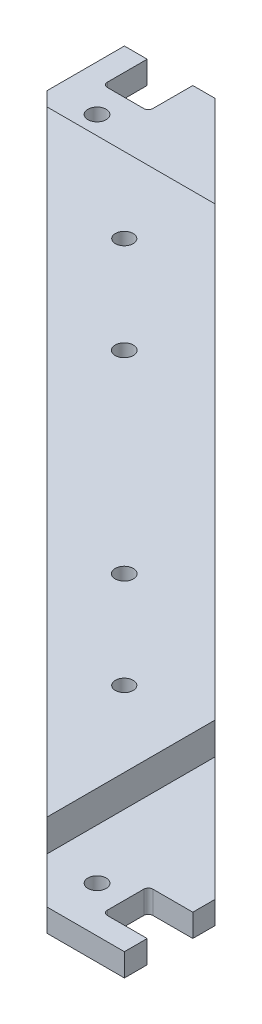
from build123d import *

# Parameters (mm, degrees)
BOSS_EXTRUDE1_DEPTH      = 12
SKETCH2_R                = 2
CUT_EXTRUDE1_DEPTH       = 244.893675605
SKETCH3_W                = 47.3
SKETCH3_H                = 27.3
SKETCH3_W_2              = 27.3
SKETCH3_H_2              = 47.3
CUT_EXTRUDE2_DEPTH       = 7
CUT_EXTRUDE8_DEPTH       = 244.893675605
CUT_EXTRUDE8_DEPTH_BACK  = 244.893675605
SKETCH5_R                = 1.95
SKETCH5_R_2              = 2
CUT_EXTRUDE10_DEPTH      = 244.893675605
CUT_EXTRUDE10_DEPTH_BACK = 244.893675605
SKETCH9_W                = 10
SKETCH9_H                = 9.75
SKETCH9_W_2              = 9.75
SKETCH9_H_2              = 10
CUT_EXTRUDE11_DEPTH      = 244.522201247
FILLET1_R                = 1


# Read off the part's stored shape, not the designer's step: Boss-Extrude1
with BuildPart() as part:
    # Boss-Extrude1 outline → Boss-Extrude1 (new body)
    with BuildSketch(Plane(origin=(0, 0, 0), x_dir=(1, 0, 0), z_dir=(0, 1, 0))):
        Polygon((0, 0), (0, -17.25), (155, -172.25), (172.25, -172.25), (172.25, -152.25), (20, 0), align=None)
    extrude(amount=BOSS_EXTRUDE1_DEPTH)

    # Sketch2 → Cut-Extrude1 (cut, through all)
    with BuildSketch(Plane(origin=(0, 12, 0), x_dir=(1, 0, 0), z_dir=(0, 1, 0))):
        with Locations(Location((10, -16.25, 0), (0, 0, 270))):
            Circle(SKETCH2_R)
        with Locations(Location((156, -162.25, 0), (0, 0, 270))):
            Circle(SKETCH2_R)
    extrude(amount=-CUT_EXTRUDE1_DEPTH, mode=Mode.SUBTRACT)

    # Sketch3 → Cut-Extrude2 (cut)
    with BuildSketch(Plane(origin=(0, 12, 0), x_dir=(1, 0, 0), z_dir=(0, 1, 0))):
        with Locations((23.65, -13.65)):
            Rectangle(SKETCH3_W, SKETCH3_H)
        with Locations((158.6, -148.6)):
            Rectangle(SKETCH3_W_2, SKETCH3_H_2)
    extrude(amount=-CUT_EXTRUDE2_DEPTH, mode=Mode.SUBTRACT)

    # Sketch5 → Cut-Extrude8 (cut, two sides: drawn at the far end of the back side and taken through both)
    with BuildSketch(Plane(origin=(0, 0, 0), x_dir=(1, 0, 0), z_dir=(0, 1, 0)).offset(-CUT_EXTRUDE8_DEPTH_BACK)):
        with Locations(Location((128.411688245, -128.691125497, 0), (0, 0, 270))):
            Circle(SKETCH5_R)
        with Locations(Location((107.19848481, -107.477922061, 0), (0, 0, 270))):
            Circle(SKETCH5_R_2)
        with Locations(Location((43.558874503, -43.838311755, 0), (0, 0, 90))):
            Circle(SKETCH5_R)
        with Locations(Location((64.772077939, -65.05151519, 0), (0, 0, 90))):
            Circle(SKETCH5_R_2)
    extrude(amount=CUT_EXTRUDE8_DEPTH + CUT_EXTRUDE8_DEPTH_BACK, mode=Mode.SUBTRACT)

    # Sketch8 → Cut-Extrude10 (cut, two sides: drawn at the far end of the back side and taken through both)
    with BuildSketch(Plane.XZ.offset(-CUT_EXTRUDE10_DEPTH_BACK)):
        Polygon((0, 497.196572238), (0, 0), (0, -10), (182, -10), (182, 172.25), (172, 172.25), (172, 152.353553391), (19.896446609, 0.25), (0, 0.25), (-497.196572238, 0.25), (205.768720009, -703.068934535), (702.965292247, -206.122362298), align=None)
    extrude(amount=CUT_EXTRUDE10_DEPTH + CUT_EXTRUDE10_DEPTH_BACK, mode=Mode.SUBTRACT)

    # Sketch9 → Cut-Extrude11 (cut, through all)
    with BuildSketch(Plane(origin=(0, 5, 0), x_dir=(1, 0, 0), z_dir=(0, 1, 0))):
        with Locations((10, -5.125)):
            Rectangle(SKETCH9_W, SKETCH9_H)
        with Locations((167.125, -162.25)):
            Rectangle(SKETCH9_W_2, SKETCH9_H_2)
    extrude(amount=-CUT_EXTRUDE11_DEPTH, mode=Mode.SUBTRACT)

    # Fillet1
    fillet1_edges = [part.edges().sort_by_distance(p)[0] for p in [
        (5, 2.5, 10),
        (15, 2.5, 10),
        (162.25, 2.5, 167.25),
        (162.25, 2.5, 157.25),
    ]]
    fillet(fillet1_edges, radius=FILLET1_R)


solid = part.part
